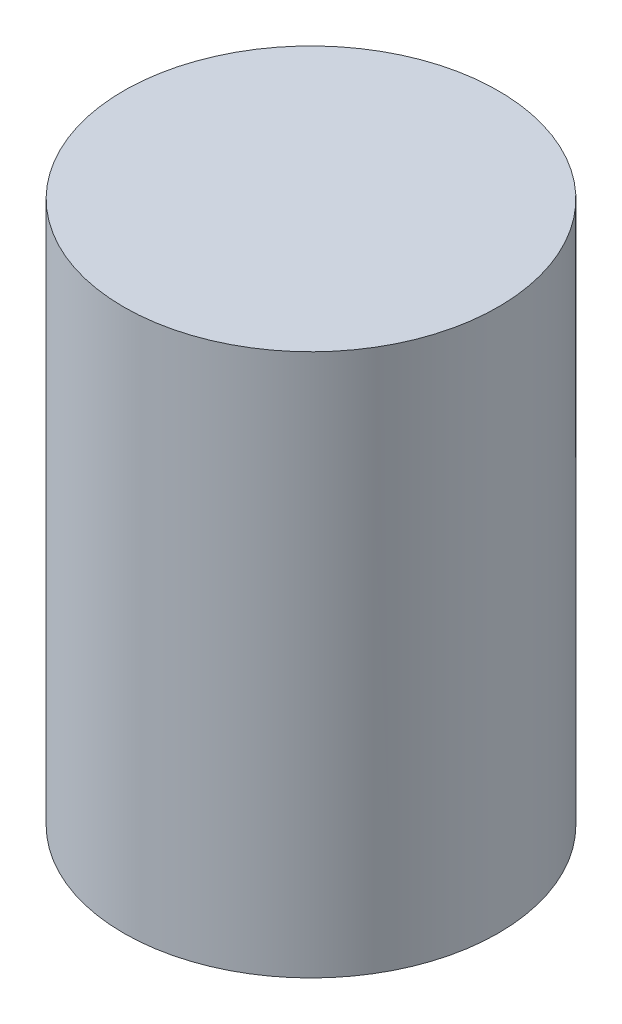
from build123d import *

# Parameters (mm, degrees)
OFFICIAL_SURFACE_TRIM_START     = -39.698691123
OFFICIAL_SURFACE_TRIM_OUTLINE_R = 25.575864924
OFFICIAL_SURFACE_TRIM_DEPTH     = 74.051423841


# Read off the part's stored shape, not the designer's step: official_surface_trim
with BuildPart() as part:
    # official_surface_trim outline → official_surface_trim (new body)
    with BuildSketch(Plane(origin=(0, 0, 0), x_dir=(1, 0, 0), z_dir=(0, 1, 0)).offset(OFFICIAL_SURFACE_TRIM_START)):
        Circle(OFFICIAL_SURFACE_TRIM_OUTLINE_R)
    extrude(amount=OFFICIAL_SURFACE_TRIM_DEPTH)


solid = part.part
